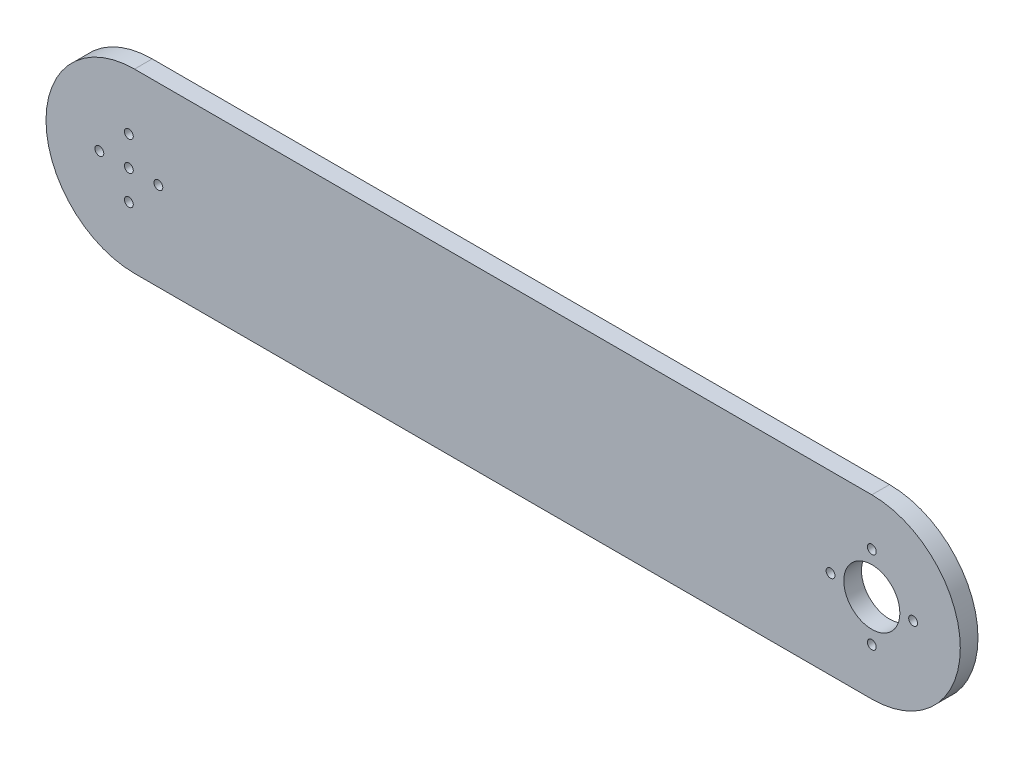
from build123d import *

# Parameters (mm, degrees)
SALIENTE_EXTRUIR1_DEPTH = 6
CROQUIS2_R              = 9.5
CORTAR_EXTRUIR4_DEPTH   = 220
CROQUIS7_R              = 1.5
CORTAR_EXTRUIR5_DEPTH   = 6
CROQUIS8_R              = 3
CROQUIS8_R_2            = 2.85
CORTAR_EXTRUIR6_DEPTH   = 0.3
CROQUIS9_4_R            = 1.5
CROQUIS9_6_R            = 1.5
CROQUIS9_7_R            = 1.5
CORTAR_EXTRUIR7_DEPTH   = 405.496155235


with BuildPart() as part:
    # Croquis1 → Saliente-Extruir1 (new body)
    with BuildSketch(Plane.XY):
        with BuildLine():
            Line((120, 0), (370, 0))
            ThreePointArc((370, 0), (400, 30), (370, 60))
            Line((370, 60), (120, 60))
            ThreePointArc((120, 60), (90, 30), (120, 0))
        make_face()
    extrude(amount=SALIENTE_EXTRUIR1_DEPTH)

    # Croquis2 → Cortar-Extruir4 (cut)
    with BuildSketch(Plane.XY.offset(6)):
        with Locations((370, 30)):
            Circle(CROQUIS2_R)
    extrude(amount=-CORTAR_EXTRUIR4_DEPTH, mode=Mode.SUBTRACT)

    # Croquis7 → Cortar-Extruir5 (cut)
    with BuildSketch(Plane.XY.offset(6)):
        with Locations((370, 16)):
            Circle(CROQUIS7_R)
        with Locations((384, 30)):
            Circle(CROQUIS7_R)
        with Locations((356, 30)):
            Circle(CROQUIS7_R)
        with Locations((370, 44)):
            Circle(CROQUIS7_R)
    extrude(amount=-CORTAR_EXTRUIR5_DEPTH, mode=Mode.SUBTRACT)

    # Croquis8 → Cortar-Extruir6 (cut)
    with BuildSketch(Plane(origin=(0, 0, 0), x_dir=(-1, 0, 0), z_dir=(0, 0, -1))):
        with Locations((-150, 30)):
            Circle(CROQUIS8_R)
        with Locations((-128.0941, 30)):
            Circle(CROQUIS8_R_2)
        with Locations((-118.0941, 30)):
            Circle(CROQUIS8_R_2)
        with Locations((-108.0941, 30)):
            Circle(CROQUIS8_R_2)
        with Locations((-118.0941, 40)):
            Circle(CROQUIS8_R_2)
        with Locations((-118.0941, 20)):
            Circle(CROQUIS8_R_2)
    extrude(amount=-CORTAR_EXTRUIR6_DEPTH, mode=Mode.SUBTRACT)

    # Cortar-Recubrir1: read off the stored shape, not the designer's step
    # Cortar-Recubrir1: loft between two sections, ruled curve by curve
    cortar_recubrir1_from = [
        Edge.make_bspline([(126.732099738, 32.503488623, 0), (121.725122492, 29.779488099, 0), (124.449123016, 24.772510853, 0), (129.456100262, 27.496511377, 0), (134.463077508, 30.220511901, 0), (131.739076984, 35.227489147, 0), (126.732099738, 32.503488623, 0)], [0, 0, 0, 0, 0.5, 0.5, 0.5, 1, 1, 1, 1], 3, [1, 0.333333333, 0.333333333, 1, 0.333333333, 0.333333333, 1]),
    ]
    cortar_recubrir1_to = [
        Edge.make_bspline([(128.476256089, 31.450502232, 1.86), (125.575251625, 32.214814409, 1.86), (124.810939448, 29.313809945, 1.86), (127.711943911, 28.549497768, 1.86), (130.612948375, 27.785185591, 1.86), (131.377260552, 30.686190055, 1.86), (128.476256089, 31.450502232, 1.86)], [0, 0, 0, 0, 0.5, 0.5, 0.5, 1, 1, 1, 1], 3, [1, 0.333333333, 0.333333333, 1, 0.333333333, 0.333333333, 1]),
    ]
    cortar_recubrir1 = Solid(Shell([*[Face.make_surface_from_curves(cortar_recubrir1_from[k], cortar_recubrir1_to[k]) for k in range(1)], Face(Wire(cortar_recubrir1_from)), Face(Wire(cortar_recubrir1_to))]))
    add(cortar_recubrir1, mode=Mode.SUBTRACT)

    # Cortar-Recubrir2: read off the stored shape, not the designer's step
    # Cortar-Recubrir2: loft between two sections, ruled curve by curve
    cortar_recubrir2_from = [
        Edge.make_bspline([(116.824217171, 32.551450098, 0.3), (111.721316976, 30.01168444, 0.3), (114.261082633, 24.908784245, 0.3), (119.363982829, 27.448549902, 0.3), (124.466883024, 29.98831556, 0.3), (121.927117367, 35.091215755, 0.3), (116.824217171, 32.551450098, 0.3)], [0, 0, 0, 0, 0.5, 0.5, 0.5, 1, 1, 1, 1], 3, [1, 0.333333333, 0.333333333, 1, 0.333333333, 0.333333333, 1]),
    ]
    cortar_recubrir2_to = [
        Edge.make_bspline([(119.35039206, 30.81959152, 1.86), (117.71120902, 33.33217564, 1.86), (115.1986249, 31.6929926, 1.86), (116.83780794, 29.18040848, 1.86), (118.47699098, 26.66782436, 1.86), (120.9895751, 28.3070074, 1.86), (119.35039206, 30.81959152, 1.86)], [0, 0, 0, 0, 0.5, 0.5, 0.5, 1, 1, 1, 1], 3, [1, 0.333333333, 0.333333333, 1, 0.333333333, 0.333333333, 1]),
    ]
    cortar_recubrir2 = Solid(Shell([*[Face.make_surface_from_curves(cortar_recubrir2_from[k], cortar_recubrir2_to[k]) for k in range(1)], Face(Wire(cortar_recubrir2_from)), Face(Wire(cortar_recubrir2_to))]))
    add(cortar_recubrir2, mode=Mode.SUBTRACT)

    # Croquis9<4> → section 1 of cortar_recubrir3
    with BuildSketch(Plane(origin=(0, 0, 1.86), x_dir=(-1, 0, 0), z_dir=(0, 0, -1)), mode=Mode.PRIVATE) as cortar_recubrir3_s1:
        with Locations((-118.0941, 40)):
            Circle(CROQUIS9_4_R)
    # loft up to a face of the part (cortar_recubrir3)
    loft([Face(Wire([part.edges().sort_by_distance((120.045059252, 42.077560588, 0))[0]])), cortar_recubrir3_s1.sketch], mode=Mode.SUBTRACT)

    # Cortar-Recubrir4: read off the stored shape, not the designer's step
    # Cortar-Recubrir4: loft between two sections, ruled curve by curve
    cortar_recubrir4_from = [
        Edge.make_bspline([(106.929450137, 32.601171024, 0.3), (101.727108089, 30.271871298, 0.3), (104.056407815, 25.06952925, 0.3), (109.258749863, 27.398828976, 0.3), (114.461091911, 29.728128702, 0.3), (112.131792185, 34.93047075, 0.3), (106.929450137, 32.601171024, 0.3)], [0, 0, 0, 0, 0.5, 0.5, 0.5, 1, 1, 1, 1], 3, [1, 0.333333333, 0.333333333, 1, 0.333333333, 0.333333333, 1]),
    ]
    cortar_recubrir4_to = [
        Edge.make_bspline([(108.926279517, 31.247989283, 1.86), (106.43030095, 32.912348318, 1.86), (104.765941916, 30.416369751, 1.86), (107.261920483, 28.752010717, 1.86), (109.75789905, 27.087651682, 1.86), (111.422258084, 29.583630249, 1.86), (108.926279517, 31.247989283, 1.86)], [0, 0, 0, 0, 0.5, 0.5, 0.5, 1, 1, 1, 1], 3, [1, 0.333333333, 0.333333333, 1, 0.333333333, 0.333333333, 1]),
    ]
    cortar_recubrir4 = Solid(Shell([*[Face.make_surface_from_curves(cortar_recubrir4_from[k], cortar_recubrir4_to[k]) for k in range(1)], Face(Wire(cortar_recubrir4_from)), Face(Wire(cortar_recubrir4_to))]))
    add(cortar_recubrir4, mode=Mode.SUBTRACT)

    # Croquis9<6> → section 1 of cortar_recubrir5
    with BuildSketch(Plane(origin=(0, 0, 1.86), x_dir=(-1, 0, 0), z_dir=(0, 0, -1)), mode=Mode.PRIVATE) as cortar_recubrir5_s1:
        with Locations((-118.0941, 20)):
            Circle(CROQUIS9_6_R)
    # loft up to a face of the part (cortar_recubrir5)
    loft([Face(Wire([part.edges().sort_by_distance((120.045059252, 22.077560588, 0.3))[0]])), cortar_recubrir5_s1.sketch], mode=Mode.SUBTRACT)

    # Croquis9<7> → Cortar-Extruir7 (cut, through all)
    with BuildSketch(Plane(origin=(0, 0, 1.86), x_dir=(-1, 0, 0), z_dir=(0, 0, -1))):
        with Locations((-118.0941, 20)):
            Circle(CROQUIS9_7_R)
        with Locations((-108.0941, 30)):
            Circle(CROQUIS9_7_R)
        with Locations((-118.0941, 30)):
            Circle(CROQUIS9_7_R)
        with Locations((-128.0941, 30)):
            Circle(CROQUIS9_7_R)
        with Locations((-118.0941, 40)):
            Circle(CROQUIS9_7_R)
    extrude(amount=-CORTAR_EXTRUIR7_DEPTH, mode=Mode.SUBTRACT)


solid = part.part
